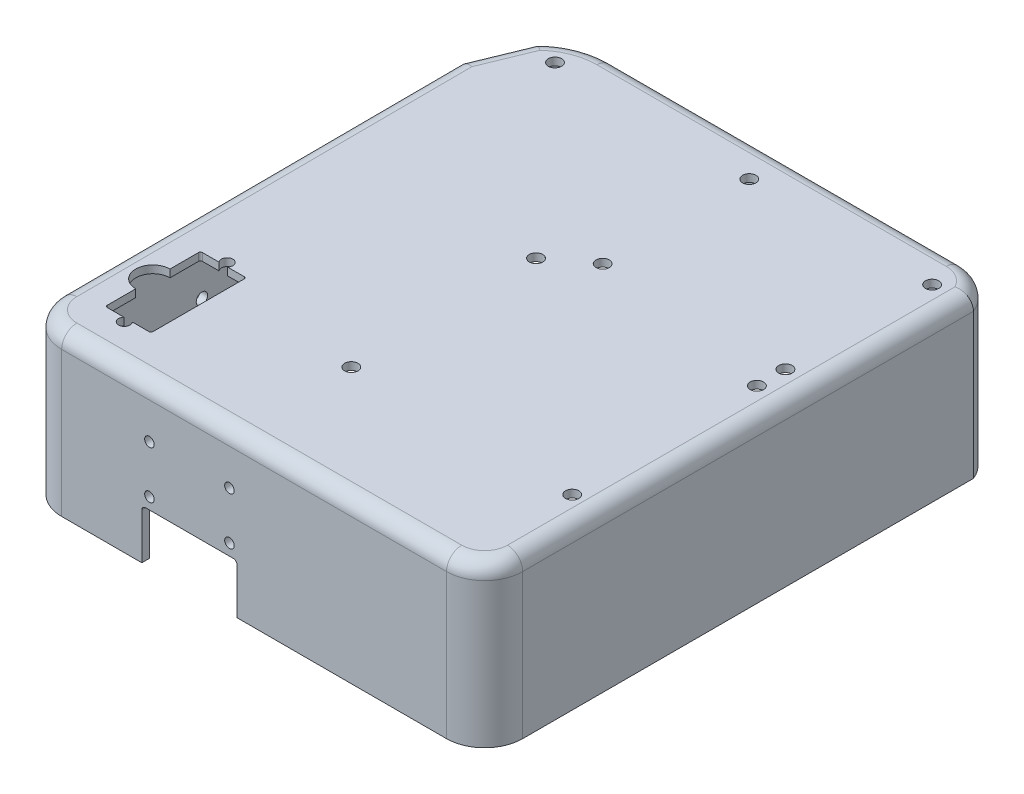
from build123d import *

# Parameters (mm, degrees)
BOSS_EXTRUDE1_DEPTH = 2
BOSS_EXTRUDE2_START = 40
BOSS_EXTRUDE2_DEPTH = 40
SKETCH3_R           = 1.25
SKETCH3_W           = 25
SKETCH3_H           = 13
CUT_EXTRUDE1_DEPTH  = 2
FILLET1_R           = 1
FILLET2_R           = 4
SKETCH5_R           = 1.5
CUT_EXTRUDE2_DEPTH  = 2
SKETCH6_R           = 1.5
CUT_EXTRUDE3_DEPTH  = 2
SKETCH7_R           = 1.75
CUT_EXTRUDE4_DEPTH  = 2
SKETCH8_R           = 1
BOSS_EXTRUDE3_DEPTH = 5
CUT_EXTRUDE5_DEPTH  = 2
SKETCH11_R          = 1.75
CUT_EXTRUDE6_DEPTH  = 10


with BuildPart() as part:
    # Sketch1 → Boss-Extrude1 (new body)
    with BuildSketch(Plane(origin=(0, 0, 0), x_dir=(1, 0, 0), z_dir=(0, 1, 0))):
        with BuildLine():
            Line((51.784977999, 114.222775894), (-39.888293568, 114.222775894))
            ThreePointArc((-39.888293568, 114.222775894), (-47.561390262, 112.692307213), (-54.060143538, 108.335134607))
            Line((-54.060143538, 108.335134607), (-59.888116608, 94.138642738))
            Line((-59.888116608, 94.138642738), (-59.446590593, -10.819290684))
            ThreePointArc((-59.446590593, -10.819290684), (-56.50285843, -17.863149091), (-49.446679073, -20.777224106))
            Line((-49.446679073, -20.777224106), (51.595299396, -20.777224106))
            ThreePointArc((51.595299396, -20.777224106), (58.666367208, -17.848291918), (61.595299396, -10.777224106))
            Line((61.595299396, -10.777224106), (61.595299396, 107.580864946))
            ThreePointArc((61.595299396, 107.580864946), (57.708604146, 112.406127459), (51.784977999, 114.222775894))
        make_face()
    extrude(amount=BOSS_EXTRUDE1_DEPTH)

    # Sketch2 → Boss-Extrude2 (add)
    with BuildSketch(Plane.XZ.offset(BOSS_EXTRUDE2_START)):
        with BuildLine():
            Line((61.595299396, -107.580864946), (61.595299396, 10.777224106))
            ThreePointArc((61.595299396, 10.777224106), (58.666367208, 17.848291918), (51.595299396, 20.777224106))
            Line((51.595299396, 20.777224106), (-49.446679073, 20.777224106))
            ThreePointArc((-49.446679073, 20.777224106), (-56.50285843, 17.863149091), (-59.446590593, 10.819290684))
            Line((-59.446590593, 10.819290684), (-59.888116608, -94.138642738))
            Line((-59.888116608, -94.138642738), (-54.060143538, -108.335134607))
            ThreePointArc((-54.060143538, -108.335134607), (-47.561390262, -112.692307213), (-39.888293568, -114.222775894))
            Line((-39.888293568, -114.222775894), (51.784977999, -114.222775894))
            ThreePointArc((51.784977999, -114.222775894), (57.708604146, -112.406127459), (61.595299396, -107.580864946))
        make_face()
        with BuildLine():
            Line((59.595299396, -107.174677903), (59.595299396, 10.777224106))
            ThreePointArc((59.595299396, 10.777224106), (57.252153645, 16.434078355), (51.595299396, 18.777224106))
            Line((51.595299396, 18.777224106), (-49.446679073, 18.777224106))
            ThreePointArc((-49.446679073, 18.777224106), (-55.091622559, 16.445964094), (-57.446608289, 10.810877368))
            Line((-57.446608289, 10.810877368), (-57.886456192, -93.748141456))
            Line((-57.886456192, -93.748141456), (-52.365631921, -107.196442593))
            ThreePointArc((-52.365631921, -107.196442593), (-46.614139218, -110.918973075), (-39.888293568, -112.222775894))
            Line((-39.888293568, -112.222775894), (51.784977999, -112.222775894))
            ThreePointArc((51.784977999, -112.222775894), (56.434827826, -110.850895784), (59.595299396, -107.174677903))
        make_face(mode=Mode.SUBTRACT)
    extrude(amount=-BOSS_EXTRUDE2_DEPTH)

    # Sketch3 → Cut-Extrude1 (cut)
    with BuildSketch(Plane.XY.offset(20.777224106)):
        with Locations((-5.404700604, -24)):
            Circle(SKETCH3_R)
        with Locations((-26.404700604, -24)):
            Circle(SKETCH3_R)
        with Locations((-5.404700604, -11.5)):
            Circle(SKETCH3_R)
        with Locations((-26.404700604, -11.5)):
            Circle(SKETCH3_R)
        with Locations((-15.904700604, -33.5)):
            Rectangle(SKETCH3_W, SKETCH3_H)
    extrude(amount=-CUT_EXTRUDE1_DEPTH, mode=Mode.SUBTRACT)

    # Fillet1
    fillet1_edges = [part.edges().sort_by_distance(p)[0] for p in [
        (-3.404700604, -27, 19.777224106),
        (-28.404700604, -27, 19.777224106),
    ]]
    fillet(fillet1_edges, radius=FILLET1_R)

    # Fillet2
    # the kernel refuses this fillet: 4 mm, written as the material it takes off along each edge
    with BuildSketch(Plane(origin=(-39.888293568, 2, -94.222775894), x_dir=(0, 0, -1), z_dir=(1, 0, 0))) as fillet2_piece_1:
        with BuildLine():
            CenterArc((20 - FILLET2_R, -FILLET2_R), FILLET2_R, 0, 90)
            Line((20, -FILLET2_R), (20 + FILLET2_R * 0.02, -FILLET2_R))
            Line((20 + FILLET2_R * 0.02, -FILLET2_R), (20 + FILLET2_R * 0.02, FILLET2_R * 0.02))
            Line((20 + FILLET2_R * 0.02, FILLET2_R * 0.02), (20 - FILLET2_R, FILLET2_R * 0.02))
            Line((20 - FILLET2_R, FILLET2_R * 0.02), (20 - FILLET2_R, 0))
        make_face()
    revolve(axis=Axis((-39.888293568, 2, -94.222775894), (0, 1, 0)), revolution_arc=56.580824864, mode=Mode.SUBTRACT)
    with BuildSketch(Plane(origin=(-52.541076777, 2, -112.035463805), x_dir=(0.9250822995860425, 0, 0.379766690209396), z_dir=(-0.3797666902093961, 0, 0.9250822995860426))) as fillet2_piece_2:
        with BuildLine():
            CenterArc((FILLET2_R, -FILLET2_R), FILLET2_R, 90, 90)
            Line((0, -FILLET2_R), (-FILLET2_R * 0.02, -FILLET2_R))
            Line((-FILLET2_R * 0.02, -FILLET2_R), (-FILLET2_R * 0.02, FILLET2_R * 0.02))
            Line((-FILLET2_R * 0.02, FILLET2_R * 0.02), (FILLET2_R, FILLET2_R * 0.02))
            Line((FILLET2_R, FILLET2_R * 0.02), (FILLET2_R, 0))
        make_face()
    extrude(amount=23.346193387, mode=Mode.SUBTRACT)
    with BuildSketch(Plane(origin=(-59.904943239, 2, -98.138607346), x_dir=(0.999991151975985, 0, -0.004206657787659257), z_dir=(0.004206657787659257, 0, 0.9999911519759851))) as fillet2_piece_3:
        with BuildLine():
            CenterArc((FILLET2_R, -FILLET2_R), FILLET2_R, 90, 90)
            Line((0, -FILLET2_R), (-FILLET2_R * 0.02, -FILLET2_R))
            Line((-FILLET2_R * 0.02, -FILLET2_R), (-FILLET2_R * 0.02, FILLET2_R * 0.02))
            Line((-FILLET2_R * 0.02, FILLET2_R * 0.02), (FILLET2_R, FILLET2_R * 0.02))
            Line((FILLET2_R, FILLET2_R * 0.02), (FILLET2_R, 0))
        make_face()
    extrude(amount=108.958862101, mode=Mode.SUBTRACT)
    with BuildSketch(Plane(origin=(-49.446679073, 2, 10.777224106), x_dir=(-0.999991151975985, 0, 0.004206657787658589), z_dir=(-0.004206657787658589, 0, -0.999991151975985))) as fillet2_piece_4:
        with BuildLine():
            CenterArc((10 - FILLET2_R, -FILLET2_R), FILLET2_R, 0, 90)
            Line((10 - FILLET2_R, 0), (10 - FILLET2_R, FILLET2_R * 0.02))
            Line((10 - FILLET2_R, FILLET2_R * 0.02), (10 + FILLET2_R * 0.02, FILLET2_R * 0.02))
            Line((10 + FILLET2_R * 0.02, FILLET2_R * 0.02), (10 + FILLET2_R * 0.02, -FILLET2_R))
            Line((10 + FILLET2_R * 0.02, -FILLET2_R), (10, -FILLET2_R))
        make_face()
    revolve(axis=Axis((-49.446679073, 2, 10.777224106), (0, 1, 0)), revolution_arc=89.758975552, mode=Mode.SUBTRACT)
    with BuildSketch(Plane(origin=(-49.446679073, 2, 20.777224106), x_dir=(0, -1, 0), z_dir=(1, 0, 0))) as fillet2_piece_5:
        with BuildLine():
            CenterArc((FILLET2_R, FILLET2_R), FILLET2_R, 180, 90)
            Line((0, FILLET2_R), (-FILLET2_R * 0.02, FILLET2_R))
            Line((-FILLET2_R * 0.02, FILLET2_R), (-FILLET2_R * 0.02, -FILLET2_R * 0.02))
            Line((-FILLET2_R * 0.02, -FILLET2_R * 0.02), (FILLET2_R, -FILLET2_R * 0.02))
            Line((FILLET2_R, -FILLET2_R * 0.02), (FILLET2_R, 0))
        make_face()
    extrude(amount=101.041978469, mode=Mode.SUBTRACT)
    with BuildSketch(Plane(origin=(51.595299396, 2, 10.777224106), x_dir=(0, 0, 1), z_dir=(-1, 0, 0))) as fillet2_piece_6:
        with BuildLine():
            CenterArc((10 - FILLET2_R, -FILLET2_R), FILLET2_R, 0, 90)
            Line((10, -FILLET2_R), (10 + FILLET2_R * 0.02, -FILLET2_R))
            Line((10 + FILLET2_R * 0.02, -FILLET2_R), (10 + FILLET2_R * 0.02, FILLET2_R * 0.02))
            Line((10 + FILLET2_R * 0.02, FILLET2_R * 0.02), (10 - FILLET2_R, FILLET2_R * 0.02))
            Line((10 - FILLET2_R, FILLET2_R * 0.02), (10 - FILLET2_R, 0))
        make_face()
    revolve(axis=Axis((51.595299396, 2, 10.777224106), (0, 1, 0)), revolution_arc=90, mode=Mode.SUBTRACT)
    with BuildSketch(Plane(origin=(61.595299396, 2, 10.777224106), x_dir=(-1, 0, 0), z_dir=(0, 0, -1))) as fillet2_piece_7:
        with BuildLine():
            CenterArc((FILLET2_R, -FILLET2_R), FILLET2_R, 90, 90)
            Line((0, -FILLET2_R), (-FILLET2_R * 0.02, -FILLET2_R))
            Line((-FILLET2_R * 0.02, -FILLET2_R), (-FILLET2_R * 0.02, FILLET2_R * 0.02))
            Line((-FILLET2_R * 0.02, FILLET2_R * 0.02), (FILLET2_R, FILLET2_R * 0.02))
            Line((FILLET2_R, FILLET2_R * 0.02), (FILLET2_R, 0))
        make_face()
    extrude(amount=122.358089052, mode=Mode.SUBTRACT)
    with BuildSketch(Plane(origin=(51.784977999, 2, -103.656736387), x_dir=(0.9999982930022114, 0, -0.0018476992891954696), z_dir=(0.0018476992891954696, 0, 0.9999982930022114))) as fillet2_piece_8:
        with BuildLine():
            CenterArc((10.566039507 - FILLET2_R, -FILLET2_R), FILLET2_R, 0, 90)
            Line((10.566039507, -FILLET2_R), (10.566039507 + FILLET2_R * 0.02, -FILLET2_R))
            Line((10.566039507 + FILLET2_R * 0.02, -FILLET2_R), (10.566039507 + FILLET2_R * 0.02, FILLET2_R * 0.02))
            Line((10.566039507 + FILLET2_R * 0.02, FILLET2_R * 0.02), (10.566039507 - FILLET2_R, FILLET2_R * 0.02))
            Line((10.566039507 - FILLET2_R, FILLET2_R * 0.02), (10.566039507 - FILLET2_R, 0))
        make_face()
    revolve(axis=Axis((51.784977999, 2, -103.656736387), (0, 1, 0)), revolution_arc=89.894134569, mode=Mode.SUBTRACT)
    with BuildSketch(Plane(origin=(51.784977999, 2, -114.222775894), x_dir=(0, 0, 1), z_dir=(-1, 0, 0))) as fillet2_piece_9:
        with BuildLine():
            CenterArc((FILLET2_R, -FILLET2_R), FILLET2_R, 90, 90)
            Line((0, -FILLET2_R), (-FILLET2_R * 0.02, -FILLET2_R))
            Line((-FILLET2_R * 0.02, -FILLET2_R), (-FILLET2_R * 0.02, FILLET2_R * 0.02))
            Line((-FILLET2_R * 0.02, FILLET2_R * 0.02), (FILLET2_R, FILLET2_R * 0.02))
            Line((FILLET2_R, FILLET2_R * 0.02), (FILLET2_R, 0))
        make_face()
    extrude(amount=91.673271567, mode=Mode.SUBTRACT)

    # Sketch5 → Cut-Extrude2 (cut)
    with BuildSketch(Plane(origin=(0, 2, 0), x_dir=(1, 0, 0), z_dir=(0, 1, 0))):
        with Locations((-43.505519715, -10.277224106)):
            Circle(SKETCH5_R)
        with Locations((-43.505519715, 16.722775894)):
            Circle(SKETCH5_R)
        with BuildLine():
            ThreePointArc((-49.505519715, 15.222775894), (-49.359073105, 15.576329285), (-49.005519715, 15.722775894))
            Line((-49.005519715, 15.722775894), (-38.005519715, 15.722775894))
            ThreePointArc((-38.005519715, 15.722775894), (-37.651966324, 15.576329285), (-37.505519715, 15.222775894))
            Line((-37.505519715, 15.222775894), (-37.505519715, -8.777224106))
            ThreePointArc((-37.505519715, -8.777224106), (-37.651966324, -9.130777496), (-38.005519715, -9.277224106))
            Line((-38.005519715, -9.277224106), (-49.005519715, -9.277224106))
            ThreePointArc((-49.005519715, -9.277224106), (-49.359073105, -9.130777496), (-49.505519715, -8.777224106))
            Line((-49.505519715, -8.777224106), (-49.505519715, 15.222775894))
        make_face()
        with BuildLine():
            ThreePointArc((-42.387485726, -9.277224106), (-43.505519715, -8.777224106), (-44.623553704, -9.277224106))
            Line((-44.623553704, -9.277224106), (-42.387485726, -9.277224106))
        make_face()
        with BuildLine():
            Line((-42.387485726, -9.277224106), (-44.623553704, -9.277224106))
            ThreePointArc((-44.623553704, -9.277224106), (-44.04075285, -11.678482644), (-42.005519715, -10.277224106))
            ThreePointArc((-42.005519715, -10.277224106), (-42.104261176, -9.741990971), (-42.387485726, -9.277224106))
        make_face()
        with BuildLine():
            ThreePointArc((-42.005519715, 16.722775894), (-44.04075285, 18.124034433), (-44.623553704, 15.722775894))
            Line((-44.623553704, 15.722775894), (-42.387485726, 15.722775894))
            ThreePointArc((-42.387485726, 15.722775894), (-42.104261176, 16.187542759), (-42.005519715, 16.722775894))
        make_face()
        with BuildLine():
            Line((-42.387485726, 15.722775894), (-44.623553704, 15.722775894))
            ThreePointArc((-44.623553704, 15.722775894), (-43.505519715, 15.222775894), (-42.387485726, 15.722775894))
        make_face()
    extrude(amount=-CUT_EXTRUDE2_DEPTH, mode=Mode.SUBTRACT)

    # Sketch6 → Cut-Extrude3 (cut)
    with BuildSketch(Plane(origin=(-59.491051279, 0, 0.250260708), x_dir=(0.004206657787659486, 0, 0.9999911519759851), z_dir=(-0.9999911519759851, 0, 0.004206657787659486))):
        with Locations((-24.430876509, -17)):
            Circle(SKETCH6_R)
        with Locations((-44.430876509, -17)):
            Circle(SKETCH6_R)
        with Locations((-64.430876509, -17)):
            Circle(SKETCH6_R)
        with Locations((-84.430876509, -17)):
            Circle(SKETCH6_R)
        with BuildLine():
            Line((-28.930876509, -36.5), (-19.930876509, -36.5))
            ThreePointArc((-19.930876509, -36.5), (-19.577323118, -36.353553391), (-19.430876509, -36))
            Line((-19.430876509, -36), (-19.430876509, -34))
            ThreePointArc((-19.430876509, -34), (-19.577323118, -33.646446609), (-19.930876509, -33.5))
            Line((-19.930876509, -33.5), (-28.930876509, -33.5))
            ThreePointArc((-28.930876509, -33.5), (-29.284429899, -33.646446609), (-29.430876509, -34))
            Line((-29.430876509, -34), (-29.430876509, -36))
            ThreePointArc((-29.430876509, -36), (-29.284429899, -36.353553391), (-28.930876509, -36.5))
        make_face()
        with BuildLine():
            Line((-49.430876509, -36), (-49.430876509, -34))
            ThreePointArc((-49.430876509, -34), (-49.284429899, -33.646446609), (-48.930876509, -33.5))
            Line((-48.930876509, -33.5), (-39.930876509, -33.5))
            ThreePointArc((-39.930876509, -33.5), (-39.577323118, -33.646446609), (-39.430876509, -34))
            Line((-39.430876509, -34), (-39.430876509, -36))
            ThreePointArc((-39.430876509, -36), (-39.577323118, -36.353553391), (-39.930876509, -36.5))
            Line((-39.930876509, -36.5), (-48.930876509, -36.5))
            ThreePointArc((-48.930876509, -36.5), (-49.284429899, -36.353553391), (-49.430876509, -36))
        make_face()
        with BuildLine():
            Line((-69.430876509, -36), (-69.430876509, -34))
            ThreePointArc((-69.430876509, -34), (-69.284429899, -33.646446609), (-68.930876509, -33.5))
            Line((-68.930876509, -33.5), (-59.930876509, -33.5))
            ThreePointArc((-59.930876509, -33.5), (-59.577323118, -33.646446609), (-59.430876509, -34))
            Line((-59.430876509, -34), (-59.430876509, -36))
            ThreePointArc((-59.430876509, -36), (-59.577323118, -36.353553391), (-59.930876509, -36.5))
            Line((-59.930876509, -36.5), (-68.930876509, -36.5))
            ThreePointArc((-68.930876509, -36.5), (-69.284429899, -36.353553391), (-69.430876509, -36))
        make_face()
        with BuildLine():
            Line((-89.430876509, -36), (-89.430876509, -34))
            ThreePointArc((-89.430876509, -34), (-89.284429899, -33.646446609), (-88.930876509, -33.5))
            Line((-88.930876509, -33.5), (-79.930876509, -33.5))
            ThreePointArc((-79.930876509, -33.5), (-79.577323118, -33.646446609), (-79.430876509, -34))
            Line((-79.430876509, -34), (-79.430876509, -36))
            ThreePointArc((-79.430876509, -36), (-79.577323118, -36.353553391), (-79.930876509, -36.5))
            Line((-79.930876509, -36.5), (-88.930876509, -36.5))
            ThreePointArc((-88.930876509, -36.5), (-89.284429899, -36.353553391), (-89.430876509, -36))
        make_face()
    extrude(amount=-CUT_EXTRUDE3_DEPTH, mode=Mode.SUBTRACT)

    # Sketch7 → Cut-Extrude4 (cut)
    with BuildSketch(Plane(origin=(0, 2, 0), x_dir=(1, 0, 0), z_dir=(0, 1, 0))):
        with Locations(Location((54.595299396, 9.222775894, 0), (0, 0, 270))):
            Circle(SKETCH7_R)
        with Locations(Location((-3.404700604, 9.222775894, 0), (0, 0, 270))):
            Circle(SKETCH7_R)
        with Locations(Location((-3.904700604, 58.220224807, 0), (0, 0, 270))):
            Circle(SKETCH7_R)
        with Locations(Location((54.095299396, 58.220224807, 0), (0, 0, 270))):
            Circle(SKETCH7_R)
        with Locations(Location((54.095299396, 104.220224807, 0), (0, 0, 270))):
            Circle(SKETCH7_R)
        with Locations(Location((54.095299396, 65.720224807, 0), (0, 0, 270))):
            Circle(SKETCH7_R)
        with Locations(Location((6.095299396, 65.720224807, 0), (0, 0, 270))):
            Circle(SKETCH7_R)
        with Locations(Location((6.095299396, 104.220224807, 0), (0, 0, 270))):
            Circle(SKETCH7_R)
    extrude(amount=-CUT_EXTRUDE4_DEPTH, mode=Mode.SUBTRACT)

    # Sketch8 → Boss-Extrude3 (add)
    # profile 1 of 4: a face of its own
    with BuildSketch(Plane.XZ.offset(40)):
        with BuildLine():
            ThreePointArc((59.595299396, -107.174677903), (56.434827826, -110.850895784), (51.784977999, -112.222775894))
            ThreePointArc((51.784977999, -112.222775894), (54.491557524, -107.844304856), (59.595299396, -107.174677903))
        make_face()
        with Locations(Location((55.784977999, -109.174677903, 0), (0, 0, 270))):
            Circle(SKETCH8_R, mode=Mode.SUBTRACT)
    # profile 2 of 4: a face of its own
    with BuildSketch(Plane.XZ.offset(40)):
        with BuildLine():
            ThreePointArc((-57.446608289, 10.810877368), (-55.091622559, 16.445964094), (-49.446679073, 18.777224106))
            ThreePointArc((-49.446679073, 18.777224106), (-51.801664804, 13.14213738), (-57.446608289, 10.810877368))
        make_face()
        with Locations(Location((-53.446608289, 14.777224106, 0), (0, 0, 270))):
            Circle(SKETCH8_R, mode=Mode.SUBTRACT)
    # profile 3 of 4: a face of its own
    with BuildSketch(Plane.XZ.offset(40)):
        with BuildLine():
            ThreePointArc((51.595299396, 18.777224106), (57.252153645, 16.434078355), (59.595299396, 10.777224106))
            ThreePointArc((59.595299396, 10.777224106), (54.022457142, 13.204381852), (51.595299396, 18.777224106))
        make_face()
        with Locations(Location((55.595299396, 14.777224106, 0), (0, 0, 270))):
            Circle(SKETCH8_R, mode=Mode.SUBTRACT)
    # profile 4 of 4: a face of its own
    with BuildSketch(Plane.XZ.offset(40)):
        with BuildLine():
            ThreePointArc((-52.365631921, -107.196442593), (-45.155527454, -107.298124354), (-39.888293568, -112.222775894))
            ThreePointArc((-39.888293568, -112.222775894), (-46.614139218, -110.918973075), (-52.365631921, -107.196442593))
        make_face()
        with Locations(Location((-46.365631921, -109.222775894, 0), (0, 0, 270))):
            Circle(SKETCH8_R, mode=Mode.SUBTRACT)
    extrude(amount=-BOSS_EXTRUDE3_DEPTH)

    # Sketch10 → Cut-Extrude5 (cut)
    with BuildSketch(Plane(origin=(0, 2, 0), x_dir=(1, 0, 0), z_dir=(0, 1, 0))):
        with BuildLine():
            Line((-49.505519715, -1.277224106), (-49.505519715, 7.722775894))
            ThreePointArc((-49.505519715, 7.722775894), (-54.005519715, 3.222775894), (-49.505519715, -1.277224106))
        make_face()
    extrude(amount=-CUT_EXTRUDE5_DEPTH, mode=Mode.SUBTRACT)

    # Sketch11 → Cut-Extrude6 (cut)
    with BuildSketch(Plane(origin=(0, 2, 0), x_dir=(1, 0, 0), z_dir=(0, 1, 0))):
        with Locations(Location((-45.934620302, 105.222775894, 0), (0, 0, 270))):
            Circle(SKETCH11_R)
    extrude(amount=-CUT_EXTRUDE6_DEPTH, mode=Mode.SUBTRACT)


solid = part.part
